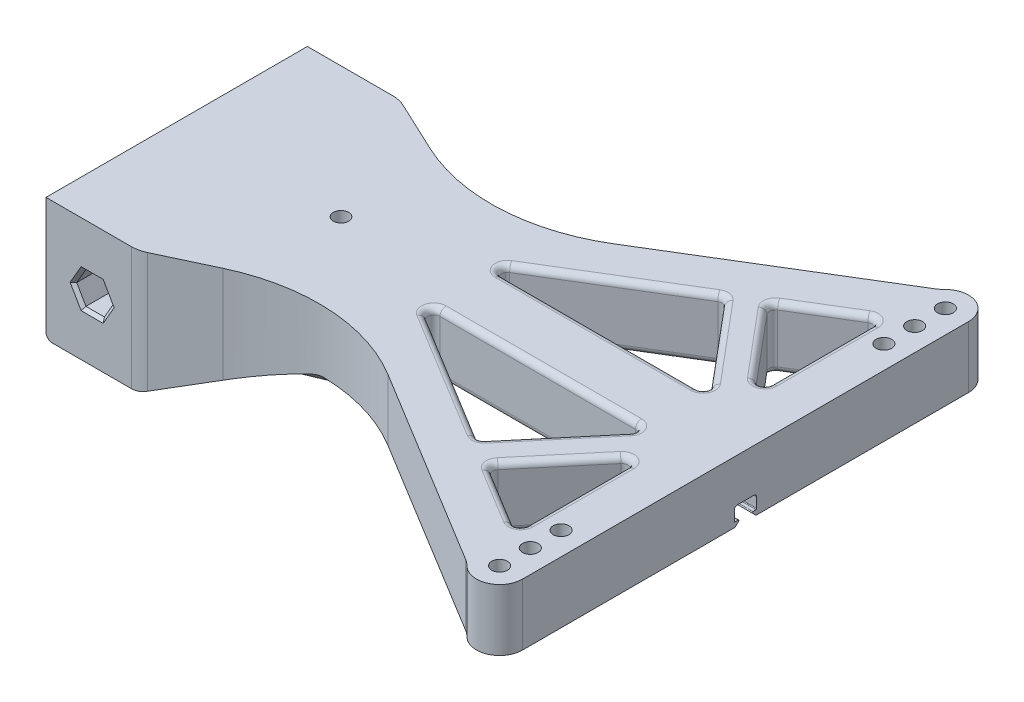
from build123d import *
from build123d.topology import SkipClean

# Parameters (mm, degrees)
SKETCH2_R               = 9.525
BOSS_EXTRUDE1_DEPTH     = 25.4
BOSS_EXTRUDE1_2_DEPTH   = 25.4
BOSS_EXTRUDE2_DEPTH     = 12.7
BOSS_EXTRUDE3_DEPTH     = 177.8
CUT_EXTRUDE1_DEPTH      = 279.767892923
BOSS_EXTRUDE4_DEPTH     = 12.7
SKETCH10_R              = 9.525
CUT_EXTRUDE3_DEPTH      = 25.4
CUT_EXTRUDE4_DEPTH      = 298.468866018
CUT_EXTRUDE4_DEPTH_BACK = 298.468866018
SKETCH11_R              = 3.2385
BOSS_EXTRUDE9_START     = -25.4
BOSS_EXTRUDE9_DEPTH     = 25.4
CUT_EXTRUDE8_DEPTH      = 300.62984873
CUT_EXTRUDE8_DEPTH_BACK = 300.62984873
BOSS_EXTRUDE11_DEPTH    = 12.7
SKETCH29_R              = 3.2385
BOSS_EXTRUDE13_DEPTH    = 12.7
FILLET6_R               = 2.54
BOSS_EXTRUDE10_DEPTH    = 76.2
FILLET14_R              = 12.7
FILLET15_R              = 2.54
SKETCH31_W              = 25.4
SKETCH31_H              = 25.4
BOSS_EXTRUDE14_DEPTH    = 48.4251
CHAMFER1_SIZE           = 13.208
CHAMFER2_SIZE           = 3.175
CHAMFER2_SIZE2          = 6.356321471
SKETCH33_R              = 3.175
CUT_EXTRUDE9_DEPTH      = 302.116964932
CHAMFER3_SIZE           = 1.27
FILLET18_R              = 12.7
FILLET19_R              = 12.7


with BuildPart() as part:
    # Sketch2 → Boss-Extrude1 (new body)
    with BuildSketch(Plane(origin=(0, 0, 0), x_dir=(1, 0, 0), z_dir=(0, 1, 0))):
        with Locations(Location((0, 0, 0), (0, 0, 270))):
            Circle(SKETCH2_R)
    extrude(amount=BOSS_EXTRUDE1_DEPTH)



with BuildPart() as body_2:
    # Sketch2 → Boss-Extrude1 2 (new body)
    with BuildSketch(Plane(origin=(0, 0, 0), x_dir=(1, 0, 0), z_dir=(0, 1, 0))):
        with Locations(Location((0, -184.15, 0), (0, 0, 270))):
            Circle(SKETCH2_R)
    extrude(amount=BOSS_EXTRUDE1_2_DEPTH)


with BuildPart() as part_1:
    with SkipClean():  # the faces are left unmerged after this step: merging them gives an invalid solid
        add(part.part)

        add(body_2.part)  # Boss-Extrude2 merges body 2
        # Sketch3 → Boss-Extrude2 (add)
        with BuildSketch(Plane(origin=(0, 25.4, 0), x_dir=(1, 0, 0), z_dir=(0, 1, 0))):
            with BuildLine():
                Line((-9.525, -184.15), (-9.525, 0))
                ThreePointArc((-9.525, 0), (0, 9.525), (9.525, 0))
                Line((9.525, 0), (9.525, -184.15))
                ThreePointArc((9.525, -184.15), (0, -193.675), (-9.525, -184.15))
            make_face()
        extrude(amount=BOSS_EXTRUDE2_DEPTH)
    add(part_1.part.scale(1), mode=Mode.REPLACE)  # the faces are merged on a copy

    # Sketch4 → Boss-Extrude3 (add)
    with SkipClean():  # the faces are left unmerged after this step: merging them gives an invalid solid
        with BuildSketch(Plane.ZY.offset(9.525)):
            Polygon((92.075, 38.1), (79.375, 38.1), (79.375, 25.4), (92.075, 25.4), (104.775, 25.4), (104.775, 38.1), align=None)
        extrude(amount=BOSS_EXTRUDE3_DEPTH)

    # Sketch5 → Cut-Extrude1 (cut, through all)
    with SkipClean():  # the faces are left unmerged after this step: merging them gives an invalid solid
        with BuildSketch(Plane.ZY.offset(187.325)):
            with BuildLine():
                Line((87.364339828, 25.4), (96.785660172, 25.4))
                ThreePointArc((96.785660172, 25.4), (96.422110911, 25.472314444), (96.11390873, 25.678248558))
                Line((96.11390873, 25.678248558), (94.912622322, 26.879534966))
                ThreePointArc((94.912622322, 26.879534966), (94.847590496, 27.20647203), (95.124754356, 27.391667))
                Line((95.124754356, 27.391667), (96.4, 27.391667))
                ThreePointArc((96.4, 27.391667), (96.612132034, 27.479534966), (96.7, 27.691667))
                Line((96.7, 27.691667), (96.7, 31.691667))
                ThreePointArc((96.7, 31.691667), (96.319238816, 32.610905816), (95.4, 32.991667))
                Line((95.4, 32.991667), (88.75, 32.991667))
                ThreePointArc((88.75, 32.991667), (87.830761184, 32.610905816), (87.45, 31.691667))
                Line((87.45, 31.691667), (87.45, 27.691667))
                ThreePointArc((87.45, 27.691667), (87.537867966, 27.479534966), (87.75, 27.391667))
                Line((87.75, 27.391667), (89.025245644, 27.391667))
                ThreePointArc((89.025245644, 27.391667), (89.302409504, 27.20647203), (89.237377678, 26.879534966))
                Line((89.237377678, 26.879534966), (88.03609127, 25.678248558))
                ThreePointArc((88.03609127, 25.678248558), (87.727889089, 25.472314444), (87.364339828, 25.4))
            make_face()
        extrude(amount=-CUT_EXTRUDE1_DEPTH, mode=Mode.SUBTRACT)

    # Sketch6 → Boss-Extrude4 (add)
    with SkipClean():  # the faces are left unmerged after this step: merging them gives an invalid solid
        with BuildSketch(Plane.XZ.offset(-25.4)):
            with BuildLine():
                Line((-225.425, 146.05), (-225.425, 38.1))
                Line((-225.425, 38.1), (-187.325, 38.1))
                Line((-187.325, 38.1), (-163.473948595, 49.287812682))
                ThreePointArc((-163.473948595, 49.287812682), (-126.967258339, 56.387413888), (-91.4483542, 45.362432278))
                Line((-91.4483542, 45.362432278), (-7.57909666, -5.769135015))
                ThreePointArc((-7.57909666, -5.769135015), (-8.087945335, 5.030980547), (1.824653291, 9.348596973))
                Line((1.824653291, 9.348596973), (-113.037118819, 79.375))
                Line((-113.037118819, 79.375), (-187.325, 79.375))
                Line((-187.325, 79.375), (-187.325, 96.785660172))
                Line((-187.325, 96.785660172), (-187.325, 104.775))
                Line((-187.325, 104.775), (-113.037118819, 104.775))
                Line((-113.037118819, 104.775), (-9.525, 167.88199563))
                Line((-9.525, 167.88199563), (-9.525, 184.15))
                ThreePointArc((-9.525, 184.15), (-9.025423001, 187.194234659), (-7.57909666, 189.919135015))
                Line((-7.57909666, 189.919135015), (-91.4483542, 138.787567722))
                ThreePointArc((-91.4483542, 138.787567722), (-126.967258339, 127.762586112), (-163.473948595, 134.862187318))
                Line((-163.473948595, 134.862187318), (-187.325, 146.05))
                Line((-187.325, 146.05), (-225.425, 146.05))
            make_face()
        extrude(amount=-BOSS_EXTRUDE4_DEPTH)

    # Sketch10 → Cut-Extrude3 (cut)
    with BuildSketch(Plane.XZ):
        Circle(SKETCH10_R)
        with Locations((0, 184.15)):
            Circle(SKETCH10_R)
    extrude(amount=-CUT_EXTRUDE3_DEPTH, mode=Mode.SUBTRACT)

    # Sketch11 → Cut-Extrude4 (cut, two sides: drawn at the far end of the back side and taken through both)
    with BuildSketch(Plane.XZ.offset(-25.4).offset(-CUT_EXTRUDE4_DEPTH_BACK)):
        with Locations(Location((0, 0, 0), (0, 0, 270))):
            Circle(SKETCH11_R)
        with Locations(Location((0, 12.7, 0), (0, 0, 270))):
            Circle(SKETCH11_R)
        with Locations(Location((0, 25.4, 0), (0, 0, 270))):
            Circle(SKETCH11_R)
        with Locations(Location((0, 184.15, 0), (0, 0, 270))):
            Circle(SKETCH11_R)
        with Locations(Location((0, 171.45, 0), (0, 0, 270))):
            Circle(SKETCH11_R)
        with Locations(Location((0, 158.75, 0), (0, 0, 270))):
            Circle(SKETCH11_R)
    extrude(amount=CUT_EXTRUDE4_DEPTH + CUT_EXTRUDE4_DEPTH_BACK, mode=Mode.SUBTRACT)

    # Sketch19 → Boss-Extrude9 (add)
    with BuildSketch(Plane(origin=(0, 25.4, 0), x_dir=(1, 0, 0), z_dir=(0, 1, 0)).offset(BOSS_EXTRUDE9_START)):
        with BuildLine():
            Line((-225.425, -146.05), (-187.325, -146.05))
            Line((-187.325, -146.05), (-163.473948595, -134.862187318))
            ThreePointArc((-163.473948595, -134.862187318), (-147.690986449, -129.474654838), (-131.113989206, -127.649671896))
            Line((-131.113989206, -127.649671896), (-131.113989206, -56.500328104))
            ThreePointArc((-131.113989206, -56.500328104), (-147.690986449, -54.675345162), (-163.473948595, -49.287812682))
            Line((-163.473948595, -49.287812682), (-187.325, -38.1))
            Line((-187.325, -38.1), (-225.425, -38.1))
            Line((-225.425, -38.1), (-225.425, -146.05))
        make_face()
    extrude(amount=BOSS_EXTRUDE9_DEPTH)

    # Sketch22 → Cut-Extrude8 (cut, two sides: drawn at the far end of the back side and taken through both)
    with BuildSketch(Plane.XY.offset(-CUT_EXTRUDE8_DEPTH_BACK)):
        Polygon((-187.325, 0), (-131.113989206, 25.4), (-131.113989206, 0), (-163.473948595, 0), align=None)
        Polygon((-214.000642355, 25.4), (-210.187821178, 18.796), (-202.562178822, 18.796), (-198.749357645, 25.4), (-202.562178822, 32.004), (-210.187821178, 32.004), align=None)
    extrude(amount=CUT_EXTRUDE8_DEPTH + CUT_EXTRUDE8_DEPTH_BACK, mode=Mode.SUBTRACT)

    # Sketch25 → Boss-Extrude11 (add)
    with BuildSketch(Plane(origin=(0, 38.1, 0), x_dir=(1, 0, 0), z_dir=(0, 1, 0))):
        Polygon((-9.525, -69.496153699), (-39.073021297, -34.282193164), (-50.040915713, -40.968858193), (-17.814336287, -79.375), (-9.525, -79.375), align=None)
        Polygon((-9.525, -104.775), (-17.814336287, -104.775), (-50.040915713, -143.181141807), (-39.073021297, -149.867806836), (-9.525, -114.653846301), align=None)
    extrude(amount=-BOSS_EXTRUDE11_DEPTH)

    # Sketch29 → Boss-Extrude13 (add)
    with SkipClean():  # the faces are left unmerged after this step: merging them gives an invalid solid
        with BuildSketch(Plane(origin=(0, 38.1, 0), x_dir=(1, 0, 0), z_dir=(0, 1, 0))):
            with BuildLine():
                Line((-91.4483542, -138.787567722), (-7.57909666, -189.919135015))
                ThreePointArc((-7.57909666, -189.919135015), (3.044234659, -193.175423001), (9.525, -184.15))
                Line((9.525, -184.15), (9.525, 0))
                ThreePointArc((9.525, 0), (3.044234659, 9.025423001), (-7.57909666, 5.769135015))
                Line((-7.57909666, 5.769135015), (-91.4483542, -45.362432278))
                ThreePointArc((-91.4483542, -45.362432278), (-126.967258339, -56.387413888), (-163.473948595, -49.287812682))
                Line((-163.473948595, -49.287812682), (-187.325, -38.1))
                Line((-187.325, -38.1), (-225.425, -38.1))
                Line((-225.425, -38.1), (-225.425, -146.05))
                Line((-225.425, -146.05), (-187.325, -146.05))
                Line((-187.325, -146.05), (-163.473948595, -134.862187318))
                ThreePointArc((-163.473948595, -134.862187318), (-126.967258339, -127.762586112), (-91.4483542, -138.787567722))
            make_face()
            with Locations(Location((0, -171.45, 0), (0, 0, 270))):
                Circle(SKETCH29_R, mode=Mode.SUBTRACT)
            with Locations(Location((0, -25.4, 0), (0, 0, 270))):
                Circle(SKETCH29_R, mode=Mode.SUBTRACT)
            with Locations(Location((0, -12.7, 0), (0, 0, 270))):
                Circle(SKETCH29_R, mode=Mode.SUBTRACT)
            with Locations(Location((0, -184.15, 0), (0, 0, 270))):
                Circle(SKETCH29_R, mode=Mode.SUBTRACT)
            with Locations(Location((0, -158.75, 0), (0, 0, 270))):
                Circle(SKETCH29_R, mode=Mode.SUBTRACT)
            with Locations(Location((0, 0, 0), (0, 0, 270))):
                Circle(SKETCH29_R, mode=Mode.SUBTRACT)
            Polygon((-17.814336287, -104.775), (-113.037118819, -104.775), (-50.040915713, -143.181141807), align=None, mode=Mode.SUBTRACT)
            Polygon((-9.525, -16.26800437), (-39.073021297, -34.282193164), (-9.525, -69.496153699), align=None, mode=Mode.SUBTRACT)
            Polygon((-17.814336287, -79.375), (-50.040915713, -40.968858193), (-113.037118819, -79.375), align=None, mode=Mode.SUBTRACT)
            Polygon((-9.525, -114.653846301), (-39.073021297, -149.867806836), (-9.525, -167.88199563), align=None, mode=Mode.SUBTRACT)
        extrude(amount=BOSS_EXTRUDE13_DEPTH)

    # Fillet6
    fillet6_edges = [part_1.edges().sort_by_distance(p)[0] for p in [
        (-24.299010649, 25.4, 25.275098767),
        (-24.299010649, 25.4, 158.874901233),
        (-9.525, 44.45, 167.88199563),
        (-113.037118819, 44.45, 104.775),
        (-9.525, 31.75, 16.26800437),
        (-81.539017266, 25.4, 60.171929096),
        (-17.814336287, 44.45, 79.375),
        (-50.040915713, 44.45, 40.968858193),
        (-39.073021297, 44.45, 34.282193164),
        (-9.525, 44.45, 69.496153699),
        (-33.927626, 25.4, 60.171929096),
        (-24.299010649, 25.4, 51.889173432),
        (-81.539017266, 25.4, 123.978070904),
        (-9.525, 25.4, 141.267920965),
        (-39.073021297, 44.45, 149.867806836),
        (-33.927626, 25.4, 123.978070904),
        (-50.040915713, 44.45, 143.181141807),
        (-17.814336287, 44.45, 104.775),
        (-24.299010649, 25.4, 132.260826568),
        (-9.525, 44.45, 114.653846301),
        (-81.539017266, 50.8, 123.978070904),
        (-33.927626, 50.8, 123.978070904),
        (-65.425727553, 50.8, 104.775),
        (-24.299010649, 50.8, 51.889173432),
        (-9.525, 50.8, 42.882079035),
        (-24.299010649, 50.8, 25.275098767),
        (-81.539017266, 50.8, 60.171929096),
        (-65.425727553, 50.8, 79.375),
        (-33.927626, 50.8, 60.171929096),
        (-24.299010649, 50.8, 158.874901233),
        (-9.525, 50.8, 141.267920965),
        (-24.299010649, 50.8, 132.260826568),
        (-65.425727553, 25.4, 104.775),
        (-65.425727553, 25.4, 79.375),
        (-9.525, 25.4, 42.882079035),
        (-113.037118819, 44.45, 79.375),
    ]]
    fillet(fillet6_edges, radius=FILLET6_R)

    # Sketch23 → Boss-Extrude10 (add)
    with SkipClean():  # the faces are left unmerged after this step: merging them gives an invalid solid
        with BuildSketch(Plane(origin=(-187.325, 0, 0), x_dir=(0, 0, -1), z_dir=(1, 0, 0))):
            with BuildLine():
                Line((-88.03609127, 25.678248558), (-89.237377678, 26.879534966))
                ThreePointArc((-89.237377678, 26.879534966), (-89.302409504, 27.20647203), (-89.025245644, 27.391667))
                Line((-89.025245644, 27.391667), (-87.75, 27.391667))
                ThreePointArc((-87.75, 27.391667), (-87.537867966, 27.479534966), (-87.45, 27.691667))
                Line((-87.45, 27.691667), (-87.45, 31.691667))
                ThreePointArc((-87.45, 31.691667), (-87.830761184, 32.610905816), (-88.75, 32.991667))
                Line((-88.75, 32.991667), (-95.4, 32.991667))
                ThreePointArc((-95.4, 32.991667), (-96.319238816, 32.610905816), (-96.7, 31.691667))
                Line((-96.7, 31.691667), (-96.7, 27.691667))
                ThreePointArc((-96.7, 27.691667), (-96.612132034, 27.479534966), (-96.4, 27.391667))
                Line((-96.4, 27.391667), (-95.124754356, 27.391667))
                ThreePointArc((-95.124754356, 27.391667), (-94.847590496, 27.20647203), (-94.912622322, 26.879534966))
                Line((-94.912622322, 26.879534966), (-96.11390873, 25.678248558))
                ThreePointArc((-96.11390873, 25.678248558), (-96.422110911, 25.472314444), (-96.785660172, 25.4))
                Line((-96.785660172, 25.4), (-87.364339828, 25.4))
                ThreePointArc((-87.364339828, 25.4), (-87.727889089, 25.472314444), (-88.03609127, 25.678248558))
            make_face()
        extrude(amount=BOSS_EXTRUDE10_DEPTH)

    # Fillet14
    # the kernel refuses this fillet: 12.7 mm, written as the material it adds along each edge
    with BuildSketch(Plane(origin=(-131.113989206, 25.4, 96.785660172), x_dir=(1, 0, 0), z_dir=(0, 0, -1))) as fillet14_piece_1:
        with BuildLine():
            CenterArc((FILLET14_R * 0.215447085161, FILLET14_R), FILLET14_R, 245.683275549, 24.316724451)
            Line((-FILLET14_R * 0.196333291553, FILLET14_R * 0.0887168818892), (0, 0))
            Line((0, 0), (FILLET14_R * 0.215447085161, 0))
        make_face()
    extrude(amount=9.421320344)
    with BuildSketch(Plane(origin=(-131.113989206, 25.4, 134.49011685), x_dir=(-0.9112831181107554, -0.4117803767135327, 0), z_dir=(0, 0, -1))) as fillet14_piece_2_section:
        with BuildLine():
            CenterArc((FILLET14_R * 0.215447085161, -FILLET14_R), FILLET14_R, 90, 24.316724451)
            Line((-FILLET14_R * 0.196333291553, -FILLET14_R * 0.0887168818892), (0, 0))
            Line((0, 0), (FILLET14_R * 0.215447085161, 0))
        make_face()
    fillet14_piece_2 = extrude(amount=37.704456678, mode=Mode.PRIVATE)
    fillet14_piece_2 = fillet14_piece_2 - Plane(origin=(-131.113989206, 25.4, 203.849671896), x_dir=(-0.42467138305501945, 0, -0.9053475666362267), z_dir=(0, -1, 0)) * Cylinder(76.2, 87, mode=Mode.PRIVATE)
    add(fillet14_piece_2)
    with BuildSketch(Plane(origin=(-131.113989206, 25.4, 87.364339828), x_dir=(1, 0, 0), z_dir=(0, 0, -1))) as fillet14_piece_3_section:
        with BuildLine():
            CenterArc((FILLET14_R * 0.215447085161, FILLET14_R), FILLET14_R, 245.683275549, 24.316724451)
            Line((-FILLET14_R * 0.196333291553, FILLET14_R * 0.0887168818892), (0, 0))
            Line((0, 0), (FILLET14_R * 0.215447085161, 0))
        make_face()
    fillet14_piece_3 = extrude(amount=37.704456678, mode=Mode.PRIVATE)
    fillet14_piece_3 = fillet14_piece_3 - Plane(origin=(-131.113989206, 25.4, -19.699671896), x_dir=(-0.4246713830550177, 0, 0.9053475666362275), z_dir=(0, -1, 0)) * Cylinder(76.2, 87, mode=Mode.PRIVATE)
    add(fillet14_piece_3)
    # the kernel refuses this fillet: 12.7 mm, written as the material it takes off along each edge
    with BuildSketch(Plane(origin=(-187.325, 0, 31.259555046), x_dir=(0.9112831181107528, 0.4117803767135386, 0), z_dir=(0, 0, 1))) as fillet14_2_piece_1:
        with BuildLine():
            CenterArc((FILLET14_R * 0.215447085161, FILLET14_R), FILLET14_R, 245.683275549, 24.316724451)
            Line((-FILLET14_R * 0.196333291553, FILLET14_R * 0.0887168818892), (0, 0))
            Line((0, 0), (FILLET14_R * 0.215447085161, 0))
        make_face()
    extrude(amount=121.630889908, mode=Mode.SUBTRACT)
    with BuildSketch(Plane(origin=(-187.325, -7.076565267, 38.1), x_dir=(0.9053475666362271, 0, 0.42467138305501867), z_dir=(0, 1, 0)), Plane(origin=(-187.325, 38.1, 146.05), x_dir=(0.9053475666362251, 0, -0.4246713830550227), z_dir=(0, -1, 0))) as fillet14_2_piece_2:
        with BuildLine():
            CenterArc((FILLET14_R * 0.222883945424, -FILLET14_R), FILLET14_R, 90, 25.129864806)
            Line((-FILLET14_R * 0.201787437631, -FILLET14_R * 0.0946524333638), (0, 0))
            Line((0, 0), (FILLET14_R * 0.222883945424, 0))
        make_face()
    extrude(amount=45.176565267, mode=Mode.SUBTRACT)
    with BuildSketch(Plane(origin=(-187.325, 38.1, 146.05), x_dir=(-1, 0, 0), z_dir=(0, 1, 0)), Plane(origin=(-187.325, 38.1, 38.1), x_dir=(0.9053475666362278, 0, 0.42467138305501684), z_dir=(0, 1, 0))) as fillet14_2_piece_3:
        with BuildLine():
            CenterArc((FILLET14_R * 0.222883945424, -FILLET14_R), FILLET14_R, 90, 25.129864806)
            Line((-FILLET14_R * 0.201787437631, -FILLET14_R * 0.0946524333638), (0, 0))
            Line((0, 0), (FILLET14_R * 0.222883945424, 0))
        make_face()
    extrude(amount=19.776565267, mode=Mode.SUBTRACT)

    # Fillet15
    fillet15_edges = [part_1.edges().sort_by_distance(p)[0] for p in [
        (-225.425, 0, 92.075),
    ]]
    fillet(fillet15_edges, radius=FILLET15_R)

    # Sketch31 → Boss-Extrude14 (add)
    with SkipClean():  # the faces are left unmerged after this step: merging them gives an invalid solid
        with BuildSketch(Plane(origin=(0, 50.8, 0), x_dir=(1, 0, 0), z_dir=(0, 1, 0))):
            with Locations((-163.1442, -92.075)):
                Rectangle(SKETCH31_W, SKETCH31_H)
        extrude(amount=-BOSS_EXTRUDE14_DEPTH)

    # Chamfer1
    # the kernel refuses this chamfer: 13.208 mm, written as the material it adds along each edge
    with BuildSketch(Plane(origin=(-206.797561306, -8.799042219, 79.375), x_dir=(0, 0, -1), z_dir=(0.9112831181107534, 0.4117803767135376, 0))) as chamfer1_piece_1_section:
        Polygon((CHAMFER1_SIZE, 0), (0, -CHAMFER1_SIZE), (0, 0), align=None)
    chamfer1_piece_1 = extrude(amount=95.806364538, mode=Mode.PRIVATE)
    chamfer1_piece_1 = split(chamfer1_piece_1, bisect_by=Plane(origin=(-175.8442, -8.799042219, 79.375), z_dir=(1, 0, 0)), keep=Keep.TOP, mode=Mode.PRIVATE)
    chamfer1_piece_1 = split(chamfer1_piece_1, bisect_by=Plane(origin=(-150.4442, -8.799042219, 79.375), z_dir=(-1, 0, 0)), keep=Keep.TOP, mode=Mode.PRIVATE)
    chamfer1_piece_1 = split(chamfer1_piece_1, bisect_by=Plane(origin=(-206.797561306, 2.3749, 79.375), z_dir=(0, 1, 0)), keep=Keep.TOP, mode=Mode.PRIVATE)
    add(chamfer1_piece_1)
    with BuildSketch(Plane(origin=(-119.490838694, 30.652138662, 104.775), x_dir=(0, 0, 1), z_dir=(-0.9112831181107534, -0.4117803767135376, 0))) as chamfer1_piece_2_section:
        Polygon((CHAMFER1_SIZE, 0), (0, -CHAMFER1_SIZE), (0, 0), align=None)
    chamfer1_piece_2 = extrude(amount=95.806364538, mode=Mode.PRIVATE)
    chamfer1_piece_2 = split(chamfer1_piece_2, bisect_by=Plane(origin=(-175.8442, 30.652138662, 104.775), z_dir=(1, 0, 0)), keep=Keep.TOP, mode=Mode.PRIVATE)
    chamfer1_piece_2 = split(chamfer1_piece_2, bisect_by=Plane(origin=(-150.4442, 30.652138662, 104.775), z_dir=(-1, 0, 0)), keep=Keep.TOP, mode=Mode.PRIVATE)
    chamfer1_piece_2 = split(chamfer1_piece_2, bisect_by=Plane(origin=(-119.490838694, 2.3749, 104.775), z_dir=(0, 1, 0)), keep=Keep.TOP, mode=Mode.PRIVATE)
    add(chamfer1_piece_2)

    # Chamfer2
    chamfer2_edges = [part_1.edges().sort_by_distance(p)[0] for p in [
        (-150.4442, 16.665281531, 92.075),
    ]]
    chamfer2_side = [part_1.faces().sort_by_distance(p)[0] for p in [
        (-150.4442, 10.319615111, 92.075),
    ]]
    chamfer(chamfer2_edges, length=CHAMFER2_SIZE, length2=CHAMFER2_SIZE2, reference=chamfer2_side[0])

    # Sketch33 → Cut-Extrude9 (cut, through all)
    with BuildSketch(Plane.XZ.offset(-2.3749)):
        with Locations(Location((-157.5562, 92.075, 0), (0, 0, 270))):
            Circle(SKETCH33_R)
    extrude(amount=-CUT_EXTRUDE9_DEPTH, mode=Mode.SUBTRACT)

    # Chamfer3
    chamfer3_edges = [part_1.edges().sort_by_distance(p)[0] for p in [
        (-212.094231767, 22.098, 146.05),
        (-206.375, 18.796, 146.05),
        (-200.655768233, 22.098, 146.05),
        (-200.655768233, 28.702, 146.05),
        (-206.375, 32.004, 146.05),
        (-212.094231767, 28.702, 146.05),
        (-212.094231767, 28.702, 38.1),
        (-206.375, 32.004, 38.1),
        (-200.655768233, 28.702, 38.1),
        (-200.655768233, 22.098, 38.1),
        (-206.375, 18.796, 38.1),
        (-212.094231767, 22.098, 38.1),
    ]]
    chamfer(chamfer3_edges, length=CHAMFER3_SIZE)

    # Fillet18
    fillet18_edges = [part_1.edges().sort_by_distance(p)[0] for p in [
        (-7.57909666, 38.1, 189.919135015),
        (-7.57909666, 38.1, -5.769135015),
    ]]
    fillet(fillet18_edges, radius=FILLET18_R)

    # Fillet19
    # the kernel refuses this fillet: 12.7 mm, written as the material it adds along each edge
    with BuildSketch(Plane(origin=(-175.8442, 5.187814912, 140.006383126), x_dir=(-0.9112831181109471, -0.4117803767131088, -2.664237365438775e-13), z_dir=(0, 0, -1))) as fillet19_piece_1_section:
        with BuildLine():
            CenterArc((8.809353251, -12.7), FILLET19_R, 90, 37.045201322)
            Line((1.158303162, -2.563361872), (0, 0))
            Line((0, 0), (8.809353251, 0))
        make_face()
    fillet19_piece_1 = extrude(amount=95.862766253, mode=Mode.PRIVATE)
    fillet19_piece_1 = split(fillet19_piece_1, bisect_by=Plane(origin=(-160.6413955, -28.456476736, 103.086691563), z_dir=(-0.2911726967338996, 0.6443744723968422, 0.7071067811865477)), keep=Keep.TOP, mode=Mode.PRIVATE)
    fillet19_piece_1 = split(fillet19_piece_1, bisect_by=Plane(origin=(-180.3785985, 15.222583535, 128.994691563), z_dir=(-0.2911726967338996, 0.6443744723968422, -0.7071067811865477)), keep=Keep.TOP, mode=Mode.PRIVATE)
    add(fillet19_piece_1)


solid = part_1.part
